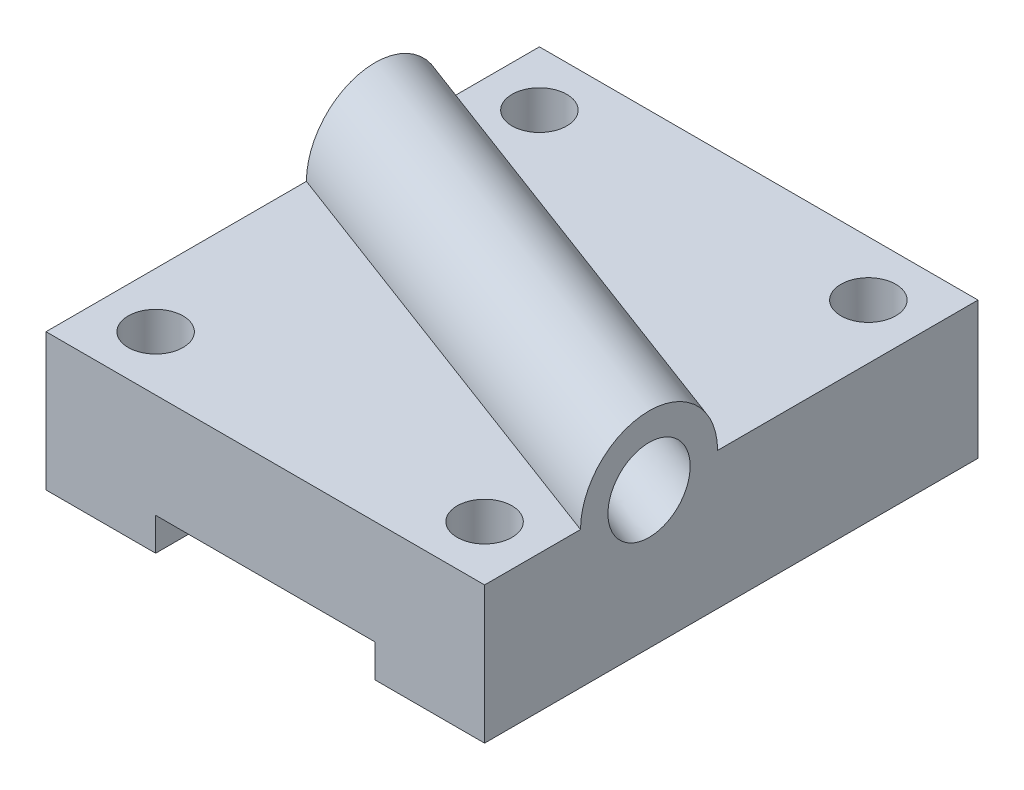
from build123d import *

# Parameters (mm, degrees)
SALIENTE_EXTRUIR1_DEPTH = 90
CORTAR_EXTRUIR1_REACH   = 124.984
CROQUIS3_R              = 5


with BuildPart() as part:
    # Croquis2 → Saliente-Extruir1 (new body)
    with BuildSketch(Plane.XY):
        Polygon((0, 0), (0, 25), (-80, 25), (-80, 0), (-60, 0), (-60, 6), (-20, 6), (-20, 0), align=None)
    extrude(amount=-SALIENTE_EXTRUIR1_DEPTH)

    # Croquis3 → Cortar-Extruir1 (cut, up to next)
    with BuildSketch(Plane(origin=(0, 25, 0), x_dir=(1, 0, 0), z_dir=(0, 1, 0)), mode=Mode.PRIVATE) as cortar_extruir1_sk1:
        with Locations(Location((-70, 80, 0), (0, 0, 180))):
            Circle(CROQUIS3_R)
    cortar_extruir1_tool1 = extrude(cortar_extruir1_sk1.sketch, amount=-CORTAR_EXTRUIR1_REACH, mode=Mode.PRIVATE) & part.part
    # Croquis3 → Cortar-Extruir1 (cut, up to next)
    with BuildSketch(Plane(origin=(0, 25, 0), x_dir=(1, 0, 0), z_dir=(0, 1, 0)), mode=Mode.PRIVATE) as cortar_extruir1_sk2:
        with Locations(Location((-10, 80, 0), (0, 0, 180))):
            Circle(CROQUIS3_R)
    cortar_extruir1_tool2 = extrude(cortar_extruir1_sk2.sketch, amount=-CORTAR_EXTRUIR1_REACH, mode=Mode.PRIVATE) & part.part
    # Croquis3 → Cortar-Extruir1 (cut, up to next)
    with BuildSketch(Plane(origin=(0, 25, 0), x_dir=(1, 0, 0), z_dir=(0, 1, 0)), mode=Mode.PRIVATE) as cortar_extruir1_sk3:
        with Locations(Location((-10, 10, 0), (0, 0, 180))):
            Circle(CROQUIS3_R)
    cortar_extruir1_tool3 = extrude(cortar_extruir1_sk3.sketch, amount=-CORTAR_EXTRUIR1_REACH, mode=Mode.PRIVATE) & part.part
    # Croquis3 → Cortar-Extruir1 (cut, up to next)
    with BuildSketch(Plane(origin=(0, 25, 0), x_dir=(1, 0, 0), z_dir=(0, 1, 0)), mode=Mode.PRIVATE) as cortar_extruir1_sk4:
        with Locations(Location((-70, 10, 0), (0, 0, 180))):
            Circle(CROQUIS3_R)
    cortar_extruir1_tool4 = extrude(cortar_extruir1_sk4.sketch, amount=-CORTAR_EXTRUIR1_REACH, mode=Mode.PRIVATE) & part.part
    add(cortar_extruir1_tool1.solids().sort_by_distance((-70, 25, -80))[0], mode=Mode.SUBTRACT)
    add(cortar_extruir1_tool2.solids().sort_by_distance((-10, 25, -80))[0], mode=Mode.SUBTRACT)
    add(cortar_extruir1_tool3.solids().sort_by_distance((-10, 25, -10))[0], mode=Mode.SUBTRACT)
    add(cortar_extruir1_tool4.solids().sort_by_distance((-70, 25, -10))[0], mode=Mode.SUBTRACT)

    # Croquis5 → Recubrir1 section 0
    with BuildSketch(Plane.ZY.offset(80)):
        with BuildLine():
            Line((-72.5, 25), (-47.5, 25))
            ThreePointArc((-47.5, 25), (-60, 37.5), (-72.5, 25))
        make_face()
    # Croquis4 → Recubrir1 section 1
    with BuildSketch(Plane(origin=(0, 0, 0), x_dir=(0, 0, -1), z_dir=(1, 0, 0))):
        with BuildLine():
            Line((42.5, 25), (17.5, 25))
            ThreePointArc((17.5, 25), (30, 37.5), (42.5, 25))
        make_face()
    loft()

    # Cortar-Recubrir1: read off the stored shape, not the designer's step
    # Cortar-Recubrir1: loft between two sections, ruled curve by curve
    cortar_recubrir1_from = [
        Edge.make_bspline([(-80, 27.8178005, -66.950539572), (-80, 28.397012131, -66.715722864), (-80, 29.023662616, -66.379666069), (-80, 29.965028032, -65.63546774), (-80, 30.27819737, -65.347207423), (-80, 30.878995513, -64.678611595), (-80, 31.166580719, -64.298055634), (-80, 31.682547567, -63.441447082), (-80, 31.910716085, -62.965172363), (-80, 32.268300366, -61.929262486), (-80, 32.397319654, -61.369555656), (-80, 32.520385943, -60.19953953), (-80, 32.51399771, -59.589467861), (-80, 32.346580783, -58.370138344), (-80, 32.18535628, -57.761411131), (-80, 31.715722864, -56.602987869), (-80, 31.407536262, -56.053840186), (-80, 30.678592509, -55.062157825), (-80, 30.258345404, -54.619867625), (-80, 29.355265136, -53.865858955), (-80, 28.87290981, -53.554007946), (-80, 27.894905327, -53.059555699), (-80, 27.399490807, -52.876626932), (-80, 26.43267588, -52.621149153), (-80, 25.961273747, -52.548292311), (-80, 25.064501609, -52.486822627), (-80, 24.639009381, -52.49802121), (-80, 23.44516904, -52.619451193), (-80, 22.761411131, -52.81464372), (-80, 21.602987869, -53.284277136), (-80, 20.976337384, -53.620333931), (-80, 20.034971968, -54.36453226), (-80, 19.72180263, -54.652792577), (-80, 19.121004487, -55.321388405), (-80, 18.833419281, -55.701944366), (-80, 18.317452433, -56.558552918), (-80, 18.089283915, -57.034827637), (-80, 17.731699634, -58.070737514), (-80, 17.602680346, -58.630444344), (-80, 17.479614057, -59.80046047), (-80, 17.48600229, -60.410532139), (-80, 17.653419217, -61.629861656), (-80, 17.81464372, -62.238588869), (-80, 18.284277136, -63.397012131), (-80, 18.592463738, -63.946159814), (-80, 19.321407491, -64.937842175), (-80, 19.741654596, -65.380132375), (-80, 20.644734864, -66.134141045), (-80, 21.12709019, -66.445992054), (-80, 22.105094673, -66.940444301), (-80, 22.600509193, -67.123373068), (-80, 23.56732412, -67.378850847), (-80, 24.038726253, -67.451707689), (-80, 24.935498391, -67.513177373), (-80, 25.360990619, -67.50197879), (-80, 26.55483096, -67.380548807), (-80, 27.238588869, -67.18535628), (-80, 27.8178005, -66.950539572)], [0, 0, 0, 0, 0.0625, 0.0625, 0.09375, 0.09375, 0.125, 0.125, 0.15625, 0.15625, 0.1875, 0.1875, 0.21875, 0.21875, 0.25, 0.25, 0.28125, 0.28125, 0.3125, 0.3125, 0.34375, 0.34375, 0.375, 0.375, 0.40625, 0.40625, 0.4375, 0.4375, 0.5, 0.5, 0.5625, 0.5625, 0.59375, 0.59375, 0.625, 0.625, 0.65625, 0.65625, 0.6875, 0.6875, 0.71875, 0.71875, 0.75, 0.75, 0.78125, 0.78125, 0.8125, 0.8125, 0.84375, 0.84375, 0.875, 0.875, 0.90625, 0.90625, 0.9375, 0.9375, 1, 1, 1, 1], 3),
    ]
    cortar_recubrir1_to = [
        Edge.make_bspline([(0, 31.377503921, -33.946827047), (0, 31.706406175, -33.415368387), (0, 32.013835032, -32.774187836), (0, 32.33435549, -31.617785382), (0, 32.416968296, -31.200239973), (0, 32.507224255, -30.305906337), (0, 32.514702079, -29.828965909), (0, 32.425496651, -28.83295266), (0, 32.328510244, -28.313826359), (0, 32.005617859, -27.266584123), (0, 31.779349551, -26.738644387), (0, 31.187995987, -25.721597678), (0, 30.822699703, -25.232939438), (0, 29.967766964, -24.347567814), (0, 29.478285707, -23.951398333), (0, 28.415368387, -23.293593825), (0, 27.84243548, -23.032270186), (0, 26.668642711, -22.662130437), (0, 26.06833886, -22.553210568), (0, 24.894293414, -22.477709998), (0, 24.320859272, -22.510740236), (0, 23.239559888, -22.688974452), (0, 22.73169069, -22.833775549), (0, 21.800495492, -23.198296471), (0, 21.37698638, -23.417768843), (0, 20.616854994, -23.897538648), (0, 20.280022745, -24.15775602), (0, 19.388077935, -24.960522771), (0, 18.951398333, -25.521714293), (0, 18.293593825, -26.584631613), (0, 17.986164968, -27.225812164), (0, 17.66564451, -28.382214618), (0, 17.583031704, -28.799760027), (0, 17.492775745, -29.694093663), (0, 17.485297921, -30.171034091), (0, 17.574503349, -31.16704734), (0, 17.671489756, -31.686173641), (0, 17.994382141, -32.733415877), (0, 18.220650449, -33.261355613), (0, 18.812004013, -34.278402322), (0, 19.177300297, -34.767060562), (0, 20.032233036, -35.652432186), (0, 20.521714293, -36.048601667), (0, 21.584631613, -36.706406175), (0, 22.15756452, -36.967729814), (0, 23.331357289, -37.337869563), (0, 23.93166114, -37.446789432), (0, 25.105706586, -37.522290002), (0, 25.679140728, -37.489259764), (0, 26.760440112, -37.311025548), (0, 27.26830931, -37.166224451), (0, 28.199504508, -36.801703529), (0, 28.62301362, -36.582231157), (0, 29.383145006, -36.102461352), (0, 29.719977255, -35.84224398), (0, 30.611922065, -35.039477229), (0, 31.048601667, -34.478285707), (0, 31.377503921, -33.946827047)], [0, 0, 0, 0, 0.0625, 0.0625, 0.09375, 0.09375, 0.125, 0.125, 0.15625, 0.15625, 0.1875, 0.1875, 0.21875, 0.21875, 0.25, 0.25, 0.28125, 0.28125, 0.3125, 0.3125, 0.34375, 0.34375, 0.375, 0.375, 0.40625, 0.40625, 0.4375, 0.4375, 0.5, 0.5, 0.5625, 0.5625, 0.59375, 0.59375, 0.625, 0.625, 0.65625, 0.65625, 0.6875, 0.6875, 0.71875, 0.71875, 0.75, 0.75, 0.78125, 0.78125, 0.8125, 0.8125, 0.84375, 0.84375, 0.875, 0.875, 0.90625, 0.90625, 0.9375, 0.9375, 1, 1, 1, 1], 3),
    ]
    cortar_recubrir1 = Solid(Shell([*[Face.make_surface_from_curves(cortar_recubrir1_from[k], cortar_recubrir1_to[k]) for k in range(1)], Face(Wire(cortar_recubrir1_from)), Face(Wire(cortar_recubrir1_to))]))
    add(cortar_recubrir1, mode=Mode.SUBTRACT)


solid = part.part
